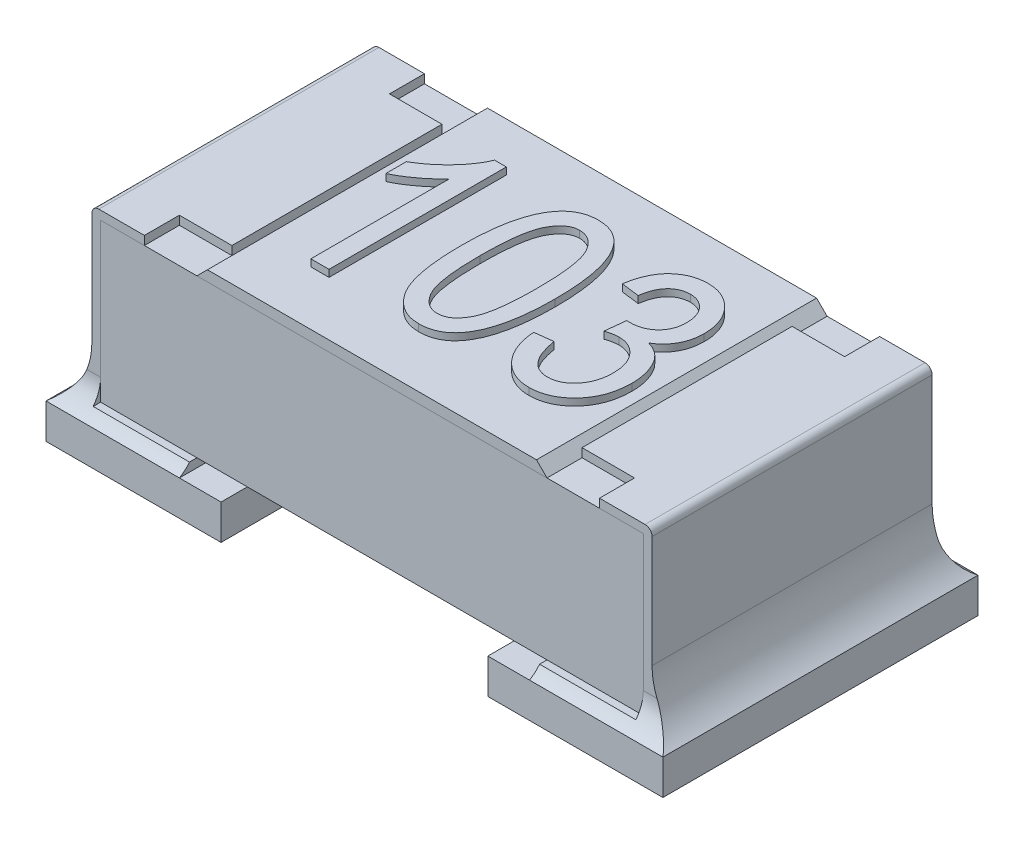
from build123d import *

# Parameters (mm, degrees)
SKETCH1_W             = 0.8
SKETCH1_H             = 0.45
BOSS_EXTRUDE1_DEPTH   = 0.775
BOSS_EXTRUDE2_DEPTH   = 0.4
BOSS_EXTRUDE2_2_DEPTH = 0.4
SKETCH3_W             = 0.15
SKETCH3_H             = 0.1
CUT_EXTRUDE1_DEPTH    = 0.025
BOSS_EXTRUDE3_DEPTH   = 0.4
SKETCH7_W             = 0.5
SKETCH7_H             = 0.9
BOSS_EXTRUDE5_DEPTH   = 0.1
FILLET3_R             = 0.2
FILLET4_R             = 0.2
FILLET5_R             = 0.1
FILLET6_R             = 0.1
BOSS_EXTRU_1_DEPTH    = 0.02


with BuildPart() as part:
    # Sketch1 → Boss-Extrude1 (new, symmetric)
    with BuildSketch(Plane(origin=(0, 0, 0), x_dir=(0, 0, -1), z_dir=(1, 0, 0))):
        with Locations((0, 0.35)):
            Rectangle(SKETCH1_W, SKETCH1_H)
    extrude(amount=BOSS_EXTRUDE1_DEPTH, both=True)


with BuildPart() as body_2:
    # Sketch2 → Boss-Extrude2 (new, symmetric)
    with BuildSketch(Plane.XY):
        with BuildLine():
            Line((-0.5, 0.6), (-0.78, 0.6))
            ThreePointArc((-0.78, 0.6), (-0.794142136, 0.594142136), (-0.8, 0.58))
            Line((-0.8, 0.58), (-0.8, 0.1))
            Line((-0.8, 0.1), (-0.5, 0.1))
            Line((-0.5, 0.1), (-0.5, 0.125))
            Line((-0.5, 0.125), (-0.775, 0.125))
            Line((-0.775, 0.125), (-0.775, 0.575))
            Line((-0.775, 0.575), (-0.5, 0.575))
            Line((-0.5, 0.575), (-0.5, 0.6))
        make_face()
    extrude(amount=BOSS_EXTRUDE2_DEPTH, both=True)


with BuildPart() as body_3:
    # Sketch2 → Boss-Extrude2 2 (new, symmetric)
    with BuildSketch(Plane.XY):
        with BuildLine():
            Line((0.5, 0.575), (0.5, 0.6))
            Line((0.5, 0.6), (0.78, 0.6))
            ThreePointArc((0.78, 0.6), (0.794142136, 0.594142136), (0.8, 0.58))
            Line((0.8, 0.58), (0.8, 0.1))
            Line((0.8, 0.1), (0.5, 0.1))
            Line((0.5, 0.1), (0.5, 0.125))
            Line((0.5, 0.125), (0.775, 0.125))
            Line((0.775, 0.125), (0.775, 0.575))
            Line((0.775, 0.575), (0.5, 0.575))
        make_face()
    extrude(amount=BOSS_EXTRUDE2_2_DEPTH, both=True)


with BuildPart() as cut_extrude1_tool:
    # Sketch3 → Cut-Extrude1 (new body)
    with BuildSketch(Plane(origin=(0, 0.6, 0), x_dir=(1, 0, 0), z_dir=(0, 1, 0))):
        with Locations((-0.575, 0.35)):
            Rectangle(SKETCH3_W, SKETCH3_H)
        with Locations((-0.575, -0.35)):
            Rectangle(SKETCH3_W, SKETCH3_H)
        with Locations((0.575, -0.35)):
            Rectangle(SKETCH3_W, SKETCH3_H)
        with Locations((0.575, 0.35)):
            Rectangle(SKETCH3_W, SKETCH3_H)
    extrude(amount=-CUT_EXTRUDE1_DEPTH)


with BuildPart() as body_2_1:
    add(body_2.part)

    # Cut-Extrude1: cut by cut_extrude1_tool
    add(cut_extrude1_tool.part, mode=Mode.SUBTRACT)



with BuildPart() as body_3_1:
    add(body_3.part)

    # Cut-Extrude1: cut by cut_extrude1_tool
    add(cut_extrude1_tool.part, mode=Mode.SUBTRACT)


with BuildPart() as body_4:
    # Sketch4 → Boss-Extrude3 (new, symmetric)
    with BuildSketch(Plane.XY):
        Polygon((-0.5, 0.575), (0.5, 0.575), (0.47, 0.605), (-0.47, 0.605), align=None)
    extrude(amount=BOSS_EXTRUDE3_DEPTH, both=True)

    # Esquisse2 → Boss.-Extru.1 (add)
    # profile 1 of 3: a face of its own
    with BuildSketch(Plane(origin=(0, 0.605, 0), x_dir=(1, 0, 0), z_dir=(0, 1, 0))):
        with BuildLine():
            Line((-0.277419159, -0.245221888), (-0.329367211, -0.245221888))
            Line((-0.329367211, -0.245221888), (-0.329367211, 0.150882009))
            add(Edge.make_bspline(
                [(-0.329367211, 0.150882009), (-0.33255753, 0.147209677), (-0.339169464, 0.139598774), (-0.350647442, 0.128775009), (-0.363438381, 0.1176135), (-0.377599648, 0.106782892), (-0.392028853, 0.096408923), (-0.406280373, 0.087284837), (-0.41982007, 0.079346193), (-0.428903295, 0.075031174), (-0.433263315, 0.072959931)],
                knots=[0, 0, 0, 0, 0.892555828, 1.849821039, 2.893015883, 4.008277588, 5.121255548, 6.154629642, 7.114207698, 8, 8, 8, 8], degree=3))
            Line((-0.433263315, 0.072959931), (-0.433263315, 0.131401489))
            add(Edge.make_bspline(
                [(-0.433263315, 0.131401489), (-0.426256411, 0.13561851), (-0.412302603, 0.144016443), (-0.392751491, 0.158564375), (-0.374281809, 0.174266475), (-0.35744561, 0.191287267), (-0.342370643, 0.208833156), (-0.329431452, 0.226343975), (-0.318822135, 0.243633673), (-0.313617925, 0.255526991), (-0.311104224, 0.261271619)],
                knots=[0, 0, 0, 0, 1.082272232, 2.155277244, 3.222407096, 4.289527553, 5.32168536, 6.282742408, 7.170542132, 8, 8, 8, 8], degree=3))
            Line((-0.311104224, 0.261271619), (-0.277419159, 0.261271619))
            Line((-0.277419159, 0.261271619), (-0.277419159, -0.245221888))
        make_face()
    # profile 2 of 3: a face of its own
    with BuildSketch(Plane(origin=(0, 0.605, 0), x_dir=(1, 0, 0), z_dir=(0, 1, 0))):
        with BuildLine():
            add(Edge.make_bspline(
                [(-0.147549029, 0.00457519), (-0.147466537, 0.01479126), (-0.147306358, 0.034628409), (-0.145650941, 0.063399949), (-0.143039858, 0.090278959), (-0.139489137, 0.115229398), (-0.134683655, 0.138255011), (-0.12902472, 0.15939274), (-0.122074419, 0.178575365), (-0.114251427, 0.195885139), (-0.105280253, 0.21122541), (-0.095389914, 0.224648892), (-0.084287025, 0.235937722), (-0.072277736, 0.245324824), (-0.059123137, 0.252476152), (-0.04501046, 0.257615666), (-0.029887534, 0.260717058), (-0.019452187, 0.261084261), (-0.014127763, 0.261271619)],
                knots=[0, 0, 0, 0, 1.522295809, 2.955932353, 4.292935845, 5.545987552, 6.709403679, 7.796379217, 8.803980711, 9.746667296, 10.623167879, 11.447716403, 12.224665142, 12.975696349, 13.710987297, 14.4460191, 15.207112772, 16, 16, 16, 16], degree=3))
            add(Edge.make_bspline(
                [(-0.014127763, 0.261271619), (-0.00938285, 0.261119405), (-6.4928e-05, 0.260820492), (0.013532278, 0.258355488), (0.026321328, 0.254161939), (0.038311883, 0.248334155), (0.04946752, 0.240809961), (0.059897997, 0.231712272), (0.069489012, 0.22085766), (0.075042737, 0.212703293), (0.0778974, 0.208511879)],
                knots=[0, 0, 0, 0, 1.02435884, 2.0116063, 2.972586715, 3.92329494, 4.881606269, 5.870473939, 6.905405214, 8, 8, 8, 8], degree=3))
            add(Edge.make_bspline(
                [(0.0778974, 0.208511879), (0.081201753, 0.202860902), (0.088073505, 0.191109101), (0.09627871, 0.171419216), (0.103194942, 0.149427268), (0.109026426, 0.125063264), (0.113186158, 0.098276968), (0.116478331, 0.069172575), (0.118383679, 0.037676929), (0.118581978, 0.015873733), (0.118684737, 0.00457519)],
                knots=[0, 0, 0, 0, 0.745747152, 1.550859881, 2.42529298, 3.372802996, 4.404287875, 5.514077945, 6.711780846, 8, 8, 8, 8], degree=3))
            add(Edge.make_bspline(
                [(0.118684737, 0.00457519), (0.118603246, -0.005573368), (0.118445039, -0.025275587), (0.116773055, -0.053910105), (0.114196761, -0.080658499), (0.110597814, -0.10553284), (0.105836898, -0.128501924), (0.100102772, -0.149633905), (0.093369381, -0.168919426), (0.085438101, -0.186231046), (0.076598991, -0.201660817), (0.066540873, -0.214948272), (0.055705564, -0.226438872), (0.043540388, -0.23562265), (0.030475546, -0.242976397), (0.016267757, -0.248029288), (0.001094421, -0.251174149), (-0.009377101, -0.25153216), (-0.014736529, -0.251715394)],
                knots=[0, 0, 0, 0, 1.513874866, 2.939007974, 4.277477108, 5.521918538, 6.686610019, 7.774777114, 8.786532326, 9.730252297, 10.61206932, 11.433487149, 12.211385775, 12.960169701, 13.698700869, 14.439280195, 15.201208188, 16, 16, 16, 16], degree=3))
            add(Edge.make_bspline(
                [(-0.014736529, -0.251715394), (-0.019516724, -0.251535975), (-0.028915126, -0.251183218), (-0.042705055, -0.248501144), (-0.05575647, -0.243876751), (-0.068138313, -0.237523555), (-0.079867046, -0.229401051), (-0.090799365, -0.219338145), (-0.101199397, -0.207599728), (-0.110942062, -0.19396939), (-0.119746041, -0.178096762), (-0.127188231, -0.159604049), (-0.133528749, -0.138579583), (-0.138560256, -0.114938484), (-0.142795274, -0.08877738), (-0.145456819, -0.059965056), (-0.147220924, -0.028557109), (-0.147436804, -0.006757381), (-0.147549029, 0.00457519)],
                knots=[0, 0, 0, 0, 0.713782411, 1.403376538, 2.088831486, 2.775699897, 3.476400496, 4.213162367, 4.989742879, 5.815463779, 6.710980744, 7.6941898, 8.787315853, 9.987366569, 11.302150399, 12.743876293, 14.307306722, 16, 16, 16, 16], degree=3))
        make_face()
        with BuildLine():
            add(Edge.make_bspline(
                [(-0.095600977, 0.004778112), (-0.095510395, -0.004962844), (-0.095337358, -0.023570963), (-0.094386416, -0.050273881), (-0.092589043, -0.074440086), (-0.090092676, -0.096145725), (-0.086927693, -0.115301137), (-0.083021376, -0.132011786), (-0.078366616, -0.146209724), (-0.072890289, -0.158097103), (-0.066817423, -0.167965156), (-0.060330818, -0.176373903), (-0.053623871, -0.183666527), (-0.046292266, -0.189491854), (-0.038680682, -0.194202042), (-0.030494994, -0.19727545), (-0.022023943, -0.199493814), (-0.016171753, -0.199675523), (-0.013214613, -0.199767342)],
                knots=[0, 0, 0, 0, 1.930873368, 3.688541263, 5.295281011, 6.732986767, 8.018032389, 9.141589856, 10.131594649, 10.974379403, 11.729767228, 12.422984227, 13.077418253, 13.687793181, 14.274134012, 14.843047171, 15.415386244, 16, 16, 16, 16], degree=3))
            add(Edge.make_bspline(
                [(-0.013214613, -0.199767342), (-0.010427064, -0.19967107), (-0.004876608, -0.199479377), (0.003214206, -0.197283662), (0.011014124, -0.194062792), (0.018392056, -0.189401372), (0.025337409, -0.183405877), (0.031944313, -0.176126804), (0.038222607, -0.167556151), (0.044243115, -0.157540122), (0.049661257, -0.145592351), (0.054269802, -0.131326946), (0.058147641, -0.114621658), (0.061355308, -0.095476215), (0.063679163, -0.073856395), (0.065539644, -0.049836144), (0.066465897, -0.023333722), (0.066643834, -0.004861208), (0.066736685, 0.004778112)],
                knots=[0, 0, 0, 0, 0.556098029, 1.107279675, 1.665020537, 2.239289732, 2.843790749, 3.494855459, 4.20099618, 4.965402842, 5.827994078, 6.818278647, 7.958442113, 9.254955883, 10.697998423, 12.305588537, 14.072183745, 16, 16, 16, 16], degree=3))
            add(Edge.make_bspline(
                [(0.066736685, 0.004778112), (0.066644247, 0.014518953), (0.066467022, 0.033194439), (0.065536544, 0.059932684), (0.063706558, 0.084163121), (0.061254358, 0.105841815), (0.058028708, 0.125018143), (0.054199757, 0.141717126), (0.049468888, 0.155886496), (0.044070333, 0.167750164), (0.037873861, 0.177530431), (0.031547138, 0.186066808), (0.024613966, 0.193179002), (0.017326453, 0.199101273), (0.009578464, 0.203716122), (0.001336, 0.207013805), (-0.007336855, 0.208998194), (-0.013272092, 0.209214654), (-0.016258444, 0.209323567)],
                knots=[0, 0, 0, 0, 1.926173374, 3.692928135, 5.28908838, 6.72993665, 8.005261178, 9.132588719, 10.113846285, 10.954579593, 11.702439438, 12.399284011, 13.051919516, 13.660808713, 14.251466784, 14.827675714, 15.41013748, 16, 16, 16, 16], degree=3))
            add(Edge.make_bspline(
                [(-0.016258444, 0.209323567), (-0.019046448, 0.209229838), (-0.024564948, 0.209044314), (-0.032588492, 0.206839344), (-0.040285896, 0.203615308), (-0.047609781, 0.198933153), (-0.054467733, 0.192853165), (-0.061128216, 0.185619176), (-0.067268818, 0.176971227), (-0.073311403, 0.16704689), (-0.078634531, 0.155067165), (-0.083250225, 0.140826575), (-0.086962575, 0.124091318), (-0.090243034, 0.105003485), (-0.092537193, 0.083411294), (-0.094405868, 0.059392779), (-0.095329633, 0.03288983), (-0.095507935, 0.014417392), (-0.095600977, 0.004778112)],
                knots=[0, 0, 0, 0, 0.557102101, 1.102712893, 1.655222221, 2.224793741, 2.834805151, 3.487045402, 4.190458401, 4.956245252, 5.811421647, 6.809929224, 7.950602775, 9.242777249, 10.688425301, 12.298918027, 14.068702942, 16, 16, 16, 16], degree=3))
        make_face(mode=Mode.SUBTRACT)
    # profile 3 of 3: a face of its own
    with BuildSketch(Plane(origin=(0, 0.605, 0), x_dir=(1, 0, 0), z_dir=(0, 1, 0))):
        with BuildLine():
            Line((0.170632789, -0.108858251), (0.222580841, -0.102364745))
            add(Edge.make_bspline(
                [(0.222580841, -0.102364745), (0.223250829, -0.106295854), (0.22455639, -0.113956147), (0.227125155, -0.124979634), (0.22992872, -0.135294754), (0.233178113, -0.144804398), (0.236720047, -0.153601456), (0.240647813, -0.161629834), (0.245039201, -0.16888819), (0.249786118, -0.175380729), (0.254903227, -0.181138198), (0.260367249, -0.186122883), (0.266229358, -0.190331218), (0.272433673, -0.193833451), (0.279078376, -0.196431554), (0.286032909, -0.198414424), (0.293399457, -0.199517263), (0.298436442, -0.199682771), (0.301010224, -0.199767342)],
                knots=[0, 0, 0, 0, 1.392235382, 2.712957193, 3.95076201, 5.123471921, 6.220028287, 7.260520794, 8.240826993, 9.178593426, 10.065213643, 10.926376853, 11.755607984, 12.580369742, 13.407158359, 14.241002189, 15.101193065, 16, 16, 16, 16], degree=3))
            add(Edge.make_bspline(
                [(0.301010224, -0.199767342), (0.303825283, -0.19971378), (0.309358329, -0.199608502), (0.31746663, -0.198040126), (0.325344292, -0.195898939), (0.332855478, -0.192563959), (0.340132453, -0.188466115), (0.347184329, -0.183522145), (0.353733984, -0.177410194), (0.360112096, -0.170691575), (0.365994713, -0.163232894), (0.371066918, -0.155086373), (0.37533871, -0.146371416), (0.378923333, -0.137192254), (0.381488545, -0.127399682), (0.383601675, -0.117188858), (0.384661656, -0.106343944), (0.384831463, -0.098950673), (0.384918504, -0.095161011)],
                knots=[0, 0, 0, 0, 0.904038564, 1.776903143, 2.648138989, 3.525264603, 4.411852617, 5.332561374, 6.2875971, 7.288147468, 8.311042921, 9.337403868, 10.368883854, 11.429611823, 12.501164111, 13.621320171, 14.780729868, 16, 16, 16, 16], degree=3))
            add(Edge.make_bspline(
                [(0.384918504, -0.095161011), (0.384826496, -0.091607761), (0.38464736, -0.084689696), (0.383662086, -0.074570464), (0.381856827, -0.064983483), (0.379159504, -0.05595494), (0.375965369, -0.047345761), (0.371888314, -0.03933172), (0.367077143, -0.031866947), (0.361634073, -0.025004423), (0.355624643, -0.018819667), (0.349286961, -0.013314715), (0.342518268, -0.008739927), (0.335489128, -0.004887872), (0.328007852, -0.002118976), (0.320292455, 8.4992e-05), (0.312175727, 0.00130226), (0.306661968, 0.001454003), (0.303851133, 0.001531359)],
                knots=[0, 0, 0, 0, 1.208507307, 2.352925112, 3.453685551, 4.520081629, 5.553915499, 6.572344605, 7.570902253, 8.569592363, 9.545641393, 10.499968035, 11.418701314, 12.319183888, 13.218416966, 14.125267075, 15.044288268, 16, 16, 16, 16], degree=3))
            add(Edge.make_bspline(
                [(0.303851133, 0.001531359), (0.301309415, 0.001451368), (0.29589117, 0.001280848), (0.287359372, -0.00019382), (0.277917334, -0.00226645), (0.271437206, -0.004300299), (0.268035387, -0.005367991)],
                knots=[0, 0, 0, 0, 0.832645691, 1.774971563, 2.831945141, 4, 4, 4, 4], degree=3))
            Line((0.268035387, -0.005367991), (0.274528893, 0.053479411))
            Line((0.274528893, 0.053479411), (0.282341393, 0.052769184))
            add(Edge.make_bspline(
                [(0.282341393, 0.052769184), (0.28535621, 0.052803375), (0.291239136, 0.052870094), (0.299843028, 0.054103025), (0.308050467, 0.05573649), (0.315778416, 0.058215582), (0.32312081, 0.06126306), (0.329963257, 0.06512583), (0.336430586, 0.069629935), (0.342407158, 0.074775592), (0.347772384, 0.080592975), (0.352565173, 0.086838036), (0.356526822, 0.093608382), (0.359818786, 0.100771608), (0.362342963, 0.108431244), (0.364185082, 0.116547048), (0.365164214, 0.125154849), (0.365345166, 0.131027254), (0.365437984, 0.134039476)],
                knots=[0, 0, 0, 0, 1.104467345, 2.155189185, 3.181695374, 4.170183668, 5.126157628, 6.092295424, 7.04536858, 8.012620263, 8.977961638, 9.942904556, 10.893715412, 11.848320646, 12.828840281, 13.845861792, 14.895045293, 16, 16, 16, 16], degree=3))
            add(Edge.make_bspline(
                [(0.365437984, 0.134039476), (0.365205154, 0.139435179), (0.364757695, 0.149804754), (0.361322938, 0.164574052), (0.355337719, 0.177647183), (0.347098304, 0.188824396), (0.337183227, 0.19783145), (0.326106912, 0.204581268), (0.31382294, 0.208580551), (0.305266447, 0.209072848), (0.300908763, 0.209323567)],
                knots=[0, 0, 0, 0, 1.168747258, 2.246123166, 3.262822778, 4.26410748, 5.234436762, 6.148309006, 7.056963545, 8, 8, 8, 8], degree=3))
            add(Edge.make_bspline(
                [(0.300908763, 0.209323567), (0.296380736, 0.209113033), (0.287572153, 0.208703473), (0.274976449, 0.204796436), (0.263388251, 0.198811303), (0.254940928, 0.191612698), (0.248954777, 0.184797154), (0.244731099, 0.179053945), (0.240977992, 0.172667561), (0.237797207, 0.165580977), (0.234735875, 0.157989828), (0.232570863, 0.149635141), (0.230408374, 0.14077154), (0.229528437, 0.134590959), (0.229074348, 0.131401489)],
                knots=[0, 0, 0, 0, 1.389180941, 2.702438466, 4.019316734, 5.377896697, 6.085434137, 6.807430375, 7.567469407, 8.358691296, 9.195188439, 10.081130764, 11.009773198, 12, 12, 12, 12], degree=3))
            Line((0.229074348, 0.131401489), (0.177126296, 0.137894996))
            add(Edge.make_bspline(
                [(0.177126296, 0.137894996), (0.177976911, 0.142845406), (0.179636207, 0.152502178), (0.183102865, 0.166397742), (0.187228647, 0.179379068), (0.19222398, 0.191374675), (0.197895954, 0.202488701), (0.204313267, 0.212674243), (0.211392332, 0.221998173), (0.219379085, 0.230202962), (0.227867658, 0.237510554), (0.236862982, 0.243821526), (0.246204676, 0.249253588), (0.256046714, 0.25362975), (0.26629668, 0.257099842), (0.277005895, 0.259528187), (0.288119335, 0.260963741), (0.2956624, 0.261168011), (0.299488309, 0.261271619)],
                knots=[0, 0, 0, 0, 1.259750421, 2.457396855, 3.589696629, 4.673763457, 5.713494597, 6.716289503, 7.690389722, 8.644478697, 9.583164327, 10.496506905, 11.397350125, 12.289843847, 13.194037124, 14.107891875, 15.040306322, 16, 16, 16, 16], degree=3))
            add(Edge.make_bspline(
                [(0.299488309, 0.261271619), (0.303519572, 0.261152706), (0.311450467, 0.260918763), (0.323107222, 0.259123737), (0.334317841, 0.256325888), (0.34505248, 0.252246796), (0.355215722, 0.246873647), (0.365057909, 0.240572938), (0.374413091, 0.233023939), (0.383134647, 0.224349983), (0.391140255, 0.214858231), (0.39816203, 0.204659864), (0.404193104, 0.193927052), (0.408982194, 0.18250432), (0.412725527, 0.170506984), (0.415460926, 0.157915535), (0.417135916, 0.144704426), (0.417301397, 0.135701715), (0.417386036, 0.131097106)],
                knots=[0, 0, 0, 0, 0.987546189, 1.94284647, 2.883618689, 3.814886987, 4.749064414, 5.696240478, 6.674807358, 7.688712876, 8.706405422, 9.713376545, 10.718845743, 11.717906576, 12.742863162, 13.794678478, 14.872046121, 16, 16, 16, 16], degree=3))
            add(Edge.make_bspline(
                [(0.417386036, 0.131097106), (0.417229743, 0.12553723), (0.416924506, 0.114678872), (0.413982335, 0.09892791), (0.409313119, 0.084150815), (0.402800714, 0.070445878), (0.394685499, 0.057883508), (0.384938112, 0.046771364), (0.373813758, 0.036921642), (0.365355289, 0.031747145), (0.361075159, 0.029128762)],
                knots=[0, 0, 0, 0, 1.090109576, 2.128968013, 3.132278696, 4.123864162, 5.09769889, 6.057339906, 7.016980922, 8, 8, 8, 8], degree=3))
            add(Edge.make_bspline(
                [(0.361075159, 0.029128762), (0.365006738, 0.027919056), (0.372688543, 0.025555446), (0.383286172, 0.020232713), (0.392949403, 0.014051368), (0.401583676, 0.006637104), (0.409263011, -0.002012587), (0.416120159, -0.011957767), (0.422011693, -0.023293485), (0.427334395, -0.035737208), (0.431505635, -0.049280075), (0.434710368, -0.063651321), (0.436527653, -0.078846612), (0.436751877, -0.089237754), (0.436866556, -0.094552245)],
                knots=[0, 0, 0, 0, 0.945190562, 1.846782401, 2.71900073, 3.580139159, 4.456653473, 5.37426406, 6.352713278, 7.392141409, 8.485180558, 9.608884637, 10.777077804, 12, 12, 12, 12], degree=3))
            add(Edge.make_bspline(
                [(0.436866556, -0.094552245), (0.436767054, -0.100206655), (0.436572795, -0.111245814), (0.434541302, -0.12742587), (0.431466768, -0.142815205), (0.427080999, -0.157468828), (0.421413591, -0.171273371), (0.414414732, -0.18430778), (0.406232011, -0.196573403), (0.396810932, -0.207898211), (0.386509539, -0.218037877), (0.375714857, -0.227099023), (0.364345387, -0.234700597), (0.352497961, -0.240980511), (0.340119591, -0.245749208), (0.327276517, -0.249234387), (0.313894434, -0.251292842), (0.304805128, -0.251573269), (0.300198536, -0.251715394)],
                knots=[0, 0, 0, 0, 1.16797173, 2.280242353, 3.364490462, 4.408173669, 5.436152277, 6.443028727, 7.460738993, 8.478233232, 9.481512989, 10.444418881, 11.386528098, 12.302557467, 13.209825675, 14.12198051, 15.04819242, 16, 16, 16, 16], degree=3))
            add(Edge.make_bspline(
                [(0.300198536, -0.251715394), (0.295930334, -0.251602688), (0.28752289, -0.25138068), (0.275179279, -0.249495111), (0.26333493, -0.246468911), (0.25203439, -0.242152829), (0.241145661, -0.236755504), (0.230837503, -0.230035031), (0.220981605, -0.222118498), (0.211720551, -0.213060002), (0.20325776, -0.202919877), (0.195571124, -0.191987861), (0.188819544, -0.180206271), (0.183323755, -0.167459779), (0.17862063, -0.15400335), (0.174859258, -0.139729734), (0.172100885, -0.124598771), (0.171128953, -0.11417798), (0.170632789, -0.108858251)],
                knots=[0, 0, 0, 0, 0.959274814, 1.889566238, 2.800731978, 3.703256649, 4.604498869, 5.528396462, 6.464265966, 7.442996794, 8.436156864, 9.429840861, 10.444772988, 11.483305447, 12.546329121, 13.647537524, 14.799087218, 16, 16, 16, 16], degree=3))
        make_face()
    extrude(amount=BOSS_EXTRU_1_DEPTH)


with BuildPart() as body_2_2:
    add(body_2_1.part)

    add(body_3_1.part)  # Boss-Extrude5 merges body 3
    # Sketch7 → Boss-Extrude5 (add)
    with BuildSketch(Plane(origin=(0, 0, 0), x_dir=(1, 0, 0), z_dir=(0, 1, 0))):
        with Locations((-0.631, 0)):
            Rectangle(SKETCH7_W, SKETCH7_H)
        with Locations((0.631, 0)):
            Rectangle(SKETCH7_W, SKETCH7_H)
    extrude(amount=BOSS_EXTRUDE5_DEPTH)

    # Fillet3
    # the kernel refuses this fillet: 0.2 mm, written as the material it adds along each edge
    with BuildSketch(Plane(origin=(-0.8, 0.1, -0.4), x_dir=(-1.0, 1.981473969784949e-11, 0), z_dir=(0, 0, 1))) as fillet3_piece_1:
        with BuildLine():
            CenterArc((0.2, -0.16074514), FILLET3_R, 126.5126321, 53.487367901)
            Line((0, -0.16074514), (-0.004, -0.16074514))
            Line((-0.004, -0.16074514), (-0.004, 0))
            Line((-0.004, 0), (0, 0.004))
            ThreePointArc((0, 0.004), (0.0405, 0.004), (0.07862, 0.003214903))
            Line((0.07862, 0.003214903), (0.081, 0))
        make_face()
    extrude(amount=0.8)

    # Fillet4
    # the kernel refuses this fillet: 0.2 mm, written as the material it adds along each edge
    with BuildSketch(Plane(origin=(0.8, 0.1, 0.4), x_dir=(1.0, 1.981542502070424e-11, 0), z_dir=(0, 0, -1))) as fillet4_piece_1:
        with BuildLine():
            CenterArc((0.2, -0.16074514), FILLET4_R, 126.5126321, 53.487367901)
            Line((0, -0.16074514), (-0.004, -0.16074514))
            Line((-0.004, -0.16074514), (-0.004, 0))
            Line((-0.004, 0), (0, 0.004))
            ThreePointArc((0, 0.004), (0.0405, 0.004), (0.07862, 0.003214903))
            Line((0.07862, 0.003214903), (0.081, 0))
        make_face()
    extrude(amount=0.8)

    # Fillet5
    # the kernel refuses this fillet: 0.1 mm, written as the material it adds along each edge
    with BuildSketch(Plane(origin=(0.5, 0.1, 0.4), x_dir=(0, -1.6392998070069752e-11, 1.0), z_dir=(1.0, 4.321346430286522e-12, 0))) as fillet5_piece_1_section:
        with BuildLine():
            CenterArc((0.1, -0.08660254), FILLET5_R, 119.999999999, 60)
            Line((0, -0.08660254), (-0.002, -0.08660254))
            Line((-0.002, -0.08660254), (-0.002, 0))
            Line((-0.002, 0), (0, 0.002))
            ThreePointArc((0, 0.002), (0.025, 0.002), (0.049, 0.001732051))
            Line((0.049, 0.001732051), (0.05, 0))
        make_face()
    fillet5_piece_1 = extrude(amount=0.381, mode=Mode.PRIVATE)
    fillet5_piece_1 = split(fillet5_piece_1, bisect_by=Plane(origin=(0.5, 0.125, 0.4), z_dir=(0, -1, 0)), keep=Keep.TOP, mode=Mode.PRIVATE)
    fillet5_piece_1 = split(fillet5_piece_1, bisect_by=Plane(origin=(0.775, 0.1, 0.4), z_dir=(-1, 0, 0)), keep=Keep.TOP, mode=Mode.PRIVATE)
    add(fillet5_piece_1)
    with BuildSketch(Plane(origin=(0.5, 0.1, 0.4), x_dir=(0, -1.6392998070069752e-11, 1.0), z_dir=(1.0, 4.321346430286522e-12, 0))) as fillet5_piece_2_section:
        with BuildLine():
            CenterArc((0.1, -0.08660254), FILLET5_R, 119.999999999, 60)
            Line((0, -0.08660254), (-0.002, -0.08660254))
            Line((-0.002, -0.08660254), (-0.002, 0))
            Line((-0.002, 0), (0, 0.002))
            ThreePointArc((0, 0.002), (0.025, 0.002), (0.049, 0.001732051))
            Line((0.049, 0.001732051), (0.05, 0))
        make_face()
    fillet5_piece_2 = extrude(amount=0.381, mode=Mode.PRIVATE)
    fillet5_piece_2 = fillet5_piece_2 - Plane(origin=(1, 0.26074514, 0.4), x_dir=(1.0, 2e-11, 0), z_dir=(0, 0, 1)) * Cylinder(0.2, 2, mode=Mode.PRIVATE)
    fillet5_piece_2 = split(fillet5_piece_2, bisect_by=Plane(origin=(0.5, 0.125, 0.4), z_dir=(0, -1, 0)), keep=Keep.TOP, mode=Mode.PRIVATE)
    fillet5_piece_2 = split(fillet5_piece_2, bisect_by=Plane(origin=(0.775, 0.1, 0.4), z_dir=(1, 0, 0)), keep=Keep.TOP, mode=Mode.PRIVATE)
    add(fillet5_piece_2)
    with BuildSketch(Plane(origin=(0.5, 0.1, 0.4), x_dir=(0, -1.6392998070069752e-11, 1.0), z_dir=(1.0, 4.321346430286522e-12, 0))) as fillet5_piece_3_section:
        with BuildLine():
            CenterArc((0.1, -0.08660254), FILLET5_R, 119.999999999, 60)
            Line((0, -0.08660254), (-0.002, -0.08660254))
            Line((-0.002, -0.08660254), (-0.002, 0))
            Line((-0.002, 0), (0, 0.002))
            ThreePointArc((0, 0.002), (0.025, 0.002), (0.049, 0.001732051))
            Line((0.049, 0.001732051), (0.05, 0))
        make_face()
    fillet5_piece_3 = extrude(amount=0.381, mode=Mode.PRIVATE)
    fillet5_piece_3 = fillet5_piece_3 - Plane(origin=(1, 0.26074514, 0.4), x_dir=(1.0, 2e-11, 0), z_dir=(0, 0, 1)) * Cylinder(0.2, 2, mode=Mode.PRIVATE)
    fillet5_piece_3 = split(fillet5_piece_3, bisect_by=Plane(origin=(0.5, 0.125, 0.4), z_dir=(0, 1, 0)), keep=Keep.TOP, mode=Mode.PRIVATE)
    fillet5_piece_3 = split(fillet5_piece_3, bisect_by=Plane(origin=(0.775, 0.1, 0.4), z_dir=(1, 0, 0)), keep=Keep.TOP, mode=Mode.PRIVATE)
    add(fillet5_piece_3)
    # the kernel refuses this fillet: 0.1 mm, written as the material it adds along each edge
    with BuildSketch(Plane(origin=(0.881, 0.1, -0.4), x_dir=(0, -1.639244295855736e-11, -1.0), z_dir=(-1.0, -4.321346430286522e-12, 0))) as fillet5_2_piece_1_section:
        with BuildLine():
            CenterArc((0.1, -0.08660254), FILLET5_R, 119.999999999, 60)
            Line((0, -0.08660254), (-0.002, -0.08660254))
            Line((-0.002, -0.08660254), (-0.002, 0))
            Line((-0.002, 0), (0, 0.002))
            ThreePointArc((0, 0.002), (0.025, 0.002), (0.049, 0.001732051))
            Line((0.049, 0.001732051), (0.05, 0))
        make_face()
    fillet5_2_piece_1 = extrude(amount=0.381, mode=Mode.PRIVATE)
    fillet5_2_piece_1 = fillet5_2_piece_1 - Plane(origin=(1, 0.26074514, -0.4), x_dir=(1.0, 2e-11, 0), z_dir=(0, 0, 1)) * Cylinder(0.2, 2, mode=Mode.PRIVATE)
    fillet5_2_piece_1 = split(fillet5_2_piece_1, bisect_by=Plane(origin=(0.881, 0.125, -0.4), z_dir=(0, -1, 0)), keep=Keep.TOP, mode=Mode.PRIVATE)
    fillet5_2_piece_1 = split(fillet5_2_piece_1, bisect_by=Plane(origin=(0.775, 0.1, -0.4), z_dir=(1, 0, 0)), keep=Keep.TOP, mode=Mode.PRIVATE)
    add(fillet5_2_piece_1)
    with BuildSketch(Plane(origin=(0.881, 0.1, -0.4), x_dir=(0, -1.639244295855736e-11, -1.0), z_dir=(-1.0, -4.321346430286522e-12, 0))) as fillet5_2_piece_2_section:
        with BuildLine():
            CenterArc((0.1, -0.08660254), FILLET5_R, 119.999999999, 60)
            Line((0, -0.08660254), (-0.002, -0.08660254))
            Line((-0.002, -0.08660254), (-0.002, 0))
            Line((-0.002, 0), (0, 0.002))
            ThreePointArc((0, 0.002), (0.025, 0.002), (0.049, 0.001732051))
            Line((0.049, 0.001732051), (0.05, 0))
        make_face()
    fillet5_2_piece_2 = extrude(amount=0.381, mode=Mode.PRIVATE)
    fillet5_2_piece_2 = fillet5_2_piece_2 - Plane(origin=(1, 0.26074514, -0.4), x_dir=(1.0, 2e-11, 0), z_dir=(0, 0, 1)) * Cylinder(0.2, 2, mode=Mode.PRIVATE)
    fillet5_2_piece_2 = split(fillet5_2_piece_2, bisect_by=Plane(origin=(0.881, 0.125, -0.4), z_dir=(0, 1, 0)), keep=Keep.TOP, mode=Mode.PRIVATE)
    fillet5_2_piece_2 = split(fillet5_2_piece_2, bisect_by=Plane(origin=(0.775, 0.1, -0.4), z_dir=(1, 0, 0)), keep=Keep.TOP, mode=Mode.PRIVATE)
    add(fillet5_2_piece_2)
    with BuildSketch(Plane(origin=(0.881, 0.1, -0.4), x_dir=(0, -1.639244295855736e-11, -1.0), z_dir=(-1.0, -4.321346430286522e-12, 0))) as fillet5_2_piece_3_section:
        with BuildLine():
            CenterArc((0.1, -0.08660254), FILLET5_R, 119.999999999, 60)
            Line((0, -0.08660254), (-0.002, -0.08660254))
            Line((-0.002, -0.08660254), (-0.002, 0))
            Line((-0.002, 0), (0, 0.002))
            ThreePointArc((0, 0.002), (0.025, 0.002), (0.049, 0.001732051))
            Line((0.049, 0.001732051), (0.05, 0))
        make_face()
    fillet5_2_piece_3 = extrude(amount=0.381, mode=Mode.PRIVATE)
    fillet5_2_piece_3 = split(fillet5_2_piece_3, bisect_by=Plane(origin=(0.881, 0.125, -0.4), z_dir=(0, -1, 0)), keep=Keep.TOP, mode=Mode.PRIVATE)
    fillet5_2_piece_3 = split(fillet5_2_piece_3, bisect_by=Plane(origin=(0.775, 0.1, -0.4), z_dir=(-1, 0, 0)), keep=Keep.TOP, mode=Mode.PRIVATE)
    add(fillet5_2_piece_3)

    # Fillet6
    # the kernel refuses this fillet: 0.1 mm, written as the material it adds along each edge
    with BuildSketch(Plane(origin=(-0.5, 0.1, -0.4), x_dir=(0, -1.6393275625825854e-11, -1.0), z_dir=(-1.0, 4.321237156366773e-12, 0))) as fillet6_piece_1_section:
        with BuildLine():
            CenterArc((0.1, -0.08660254), FILLET6_R, 119.999999999, 60)
            Line((0, -0.08660254), (-0.002, -0.08660254))
            Line((-0.002, -0.08660254), (-0.002, 0))
            Line((-0.002, 0), (0, 0.002))
            ThreePointArc((0, 0.002), (0.025, 0.002), (0.049, 0.001732051))
            Line((0.049, 0.001732051), (0.05, 0))
        make_face()
    fillet6_piece_1 = extrude(amount=0.381, mode=Mode.PRIVATE)
    fillet6_piece_1 = split(fillet6_piece_1, bisect_by=Plane(origin=(-0.5, 0.125, -0.4), z_dir=(0, -1, 0)), keep=Keep.TOP, mode=Mode.PRIVATE)
    fillet6_piece_1 = split(fillet6_piece_1, bisect_by=Plane(origin=(-0.775, 0.1, -0.4), z_dir=(1, 0, 0)), keep=Keep.TOP, mode=Mode.PRIVATE)
    add(fillet6_piece_1)
    with BuildSketch(Plane(origin=(-0.5, 0.1, -0.4), x_dir=(0, -1.6393275625825854e-11, -1.0), z_dir=(-1.0, 4.321237156366773e-12, 0))) as fillet6_piece_2_section:
        with BuildLine():
            CenterArc((0.1, -0.08660254), FILLET6_R, 119.999999999, 60)
            Line((0, -0.08660254), (-0.002, -0.08660254))
            Line((-0.002, -0.08660254), (-0.002, 0))
            Line((-0.002, 0), (0, 0.002))
            ThreePointArc((0, 0.002), (0.025, 0.002), (0.049, 0.001732051))
            Line((0.049, 0.001732051), (0.05, 0))
        make_face()
    fillet6_piece_2 = extrude(amount=0.381, mode=Mode.PRIVATE)
    fillet6_piece_2 = fillet6_piece_2 - Plane(origin=(-1, 0.26074514, -0.4), x_dir=(-1.0, 2e-11, 0), z_dir=(0, 0, -1)) * Cylinder(0.2, 2, mode=Mode.PRIVATE)
    fillet6_piece_2 = split(fillet6_piece_2, bisect_by=Plane(origin=(-0.5, 0.125, -0.4), z_dir=(0, -1, 0)), keep=Keep.TOP, mode=Mode.PRIVATE)
    fillet6_piece_2 = split(fillet6_piece_2, bisect_by=Plane(origin=(-0.775, 0.1, -0.4), z_dir=(-1, 0, 0)), keep=Keep.TOP, mode=Mode.PRIVATE)
    add(fillet6_piece_2)
    with BuildSketch(Plane(origin=(-0.5, 0.1, -0.4), x_dir=(0, -1.6393275625825854e-11, -1.0), z_dir=(-1.0, 4.321237156366773e-12, 0))) as fillet6_piece_3_section:
        with BuildLine():
            CenterArc((0.1, -0.08660254), FILLET6_R, 119.999999999, 60)
            Line((0, -0.08660254), (-0.002, -0.08660254))
            Line((-0.002, -0.08660254), (-0.002, 0))
            Line((-0.002, 0), (0, 0.002))
            ThreePointArc((0, 0.002), (0.025, 0.002), (0.049, 0.001732051))
            Line((0.049, 0.001732051), (0.05, 0))
        make_face()
    fillet6_piece_3 = extrude(amount=0.381, mode=Mode.PRIVATE)
    fillet6_piece_3 = fillet6_piece_3 - Plane(origin=(-1, 0.26074514, -0.4), x_dir=(-1.0, 2e-11, 0), z_dir=(0, 0, -1)) * Cylinder(0.2, 2, mode=Mode.PRIVATE)
    fillet6_piece_3 = split(fillet6_piece_3, bisect_by=Plane(origin=(-0.5, 0.125, -0.4), z_dir=(0, 1, 0)), keep=Keep.TOP, mode=Mode.PRIVATE)
    fillet6_piece_3 = split(fillet6_piece_3, bisect_by=Plane(origin=(-0.775, 0.1, -0.4), z_dir=(-1, 0, 0)), keep=Keep.TOP, mode=Mode.PRIVATE)
    add(fillet6_piece_3)
    # the kernel refuses this fillet: 0.1 mm, written as the material it adds along each edge
    with BuildSketch(Plane(origin=(-0.881, 0.1, 0.4), x_dir=(0, -1.6393830737338195e-11, 1.0), z_dir=(1.0, -4.321237156366773e-12, 0))) as fillet6_2_piece_1_section:
        with BuildLine():
            CenterArc((0.1, -0.08660254), FILLET6_R, 119.999999999, 60)
            Line((0, -0.08660254), (-0.002, -0.08660254))
            Line((-0.002, -0.08660254), (-0.002, 0))
            Line((-0.002, 0), (0, 0.002))
            ThreePointArc((0, 0.002), (0.025, 0.002), (0.049, 0.001732051))
            Line((0.049, 0.001732051), (0.05, 0))
        make_face()
    fillet6_2_piece_1 = extrude(amount=0.381, mode=Mode.PRIVATE)
    fillet6_2_piece_1 = fillet6_2_piece_1 - Plane(origin=(-1, 0.26074514, 0.4), x_dir=(-1.0, 2e-11, 0), z_dir=(0, 0, -1)) * Cylinder(0.2, 2, mode=Mode.PRIVATE)
    fillet6_2_piece_1 = split(fillet6_2_piece_1, bisect_by=Plane(origin=(-0.881, 0.125, 0.4), z_dir=(0, -1, 0)), keep=Keep.TOP, mode=Mode.PRIVATE)
    fillet6_2_piece_1 = split(fillet6_2_piece_1, bisect_by=Plane(origin=(-0.775, 0.1, 0.4), z_dir=(-1, 0, 0)), keep=Keep.TOP, mode=Mode.PRIVATE)
    add(fillet6_2_piece_1)
    with BuildSketch(Plane(origin=(-0.881, 0.1, 0.4), x_dir=(0, -1.6393830737338195e-11, 1.0), z_dir=(1.0, -4.321237156366773e-12, 0))) as fillet6_2_piece_2_section:
        with BuildLine():
            CenterArc((0.1, -0.08660254), FILLET6_R, 119.999999999, 60)
            Line((0, -0.08660254), (-0.002, -0.08660254))
            Line((-0.002, -0.08660254), (-0.002, 0))
            Line((-0.002, 0), (0, 0.002))
            ThreePointArc((0, 0.002), (0.025, 0.002), (0.049, 0.001732051))
            Line((0.049, 0.001732051), (0.05, 0))
        make_face()
    fillet6_2_piece_2 = extrude(amount=0.381, mode=Mode.PRIVATE)
    fillet6_2_piece_2 = fillet6_2_piece_2 - Plane(origin=(-1, 0.26074514, 0.4), x_dir=(-1.0, 2e-11, 0), z_dir=(0, 0, -1)) * Cylinder(0.2, 2, mode=Mode.PRIVATE)
    fillet6_2_piece_2 = split(fillet6_2_piece_2, bisect_by=Plane(origin=(-0.881, 0.125, 0.4), z_dir=(0, 1, 0)), keep=Keep.TOP, mode=Mode.PRIVATE)
    fillet6_2_piece_2 = split(fillet6_2_piece_2, bisect_by=Plane(origin=(-0.775, 0.1, 0.4), z_dir=(-1, 0, 0)), keep=Keep.TOP, mode=Mode.PRIVATE)
    add(fillet6_2_piece_2)
    with BuildSketch(Plane(origin=(-0.881, 0.1, 0.4), x_dir=(0, -1.6393830737338195e-11, 1.0), z_dir=(1.0, -4.321237156366773e-12, 0))) as fillet6_2_piece_3_section:
        with BuildLine():
            CenterArc((0.1, -0.08660254), FILLET6_R, 119.999999999, 60)
            Line((0, -0.08660254), (-0.002, -0.08660254))
            Line((-0.002, -0.08660254), (-0.002, 0))
            Line((-0.002, 0), (0, 0.002))
            ThreePointArc((0, 0.002), (0.025, 0.002), (0.049, 0.001732051))
            Line((0.049, 0.001732051), (0.05, 0))
        make_face()
    fillet6_2_piece_3 = extrude(amount=0.381, mode=Mode.PRIVATE)
    fillet6_2_piece_3 = split(fillet6_2_piece_3, bisect_by=Plane(origin=(-0.881, 0.125, 0.4), z_dir=(0, -1, 0)), keep=Keep.TOP, mode=Mode.PRIVATE)
    fillet6_2_piece_3 = split(fillet6_2_piece_3, bisect_by=Plane(origin=(-0.775, 0.1, 0.4), z_dir=(1, 0, 0)), keep=Keep.TOP, mode=Mode.PRIVATE)
    add(fillet6_2_piece_3)


solid = Compound([part.part, body_4.part, body_2_2.part])
